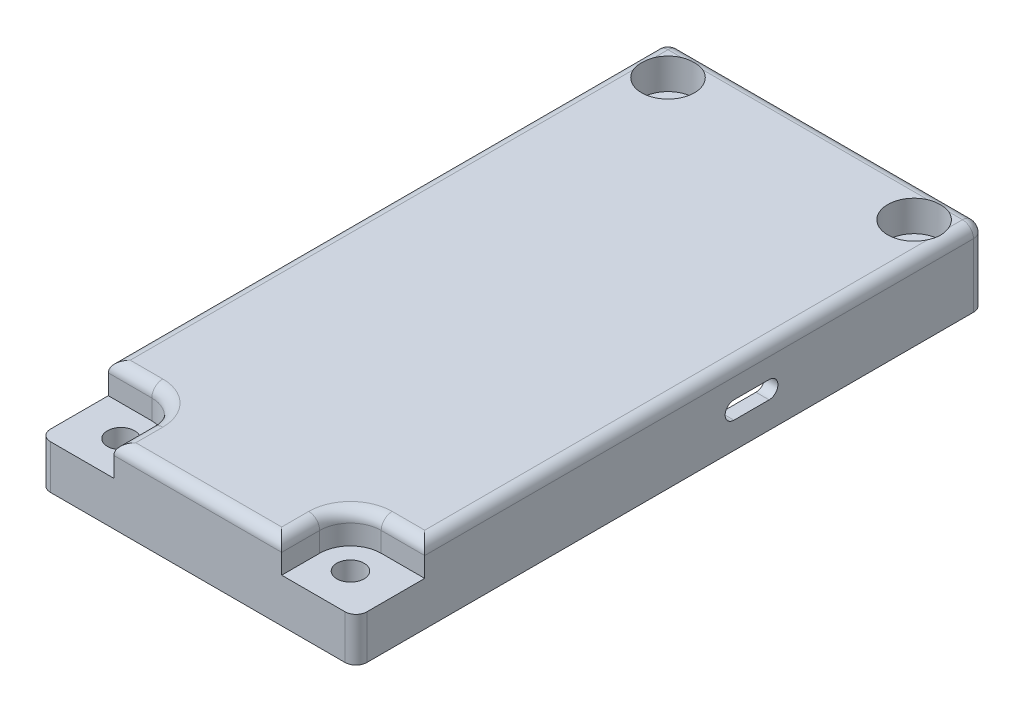
from build123d import *

# Parameters (mm, degrees)
SKETCH1_W           = 36
SKETCH1_H           = 71.5
BOSS_EXTRUDE1_DEPTH = 8.5
SKETCH2_W           = 33
SKETCH2_H           = 62.75
CUT_EXTRUDE1_DEPTH  = 7
SKETCH4_W           = 16
SKETCH4_H           = 1.25
CUT_EXTRUDE2_DEPTH  = 6.5
FILLET1_R           = 1.25
SKETCH7_W           = 7
SKETCH7_H           = 7
BOSS_EXTRUDE4_DEPTH = 7
SKETCH8_R           = 1.55
CUT_EXTRUDE3_DEPTH  = 81.50155278
SKETCH9_R           = 3
CUT_EXTRUDE4_DEPTH  = 3.5
CUT_EXTRUDE5_DEPTH  = 80.842031537
SKETCH11_W          = 5
SKETCH11_H          = 5
BOSS_EXTRUDE8_DEPTH = 4.31
FILLET2_R           = 1.25


# Some blends are built 0.0001 mm under size
with BuildPart() as part:
    # Sketch1 → Boss-Extrude1 (new body)
    with BuildSketch(Plane(origin=(0, 0, 0), x_dir=(1, 0, 0), z_dir=(0, 1, 0))):
        with Locations((18, 35.75)):
            Rectangle(SKETCH1_W, SKETCH1_H)
    extrude(amount=BOSS_EXTRUDE1_DEPTH)

    # Sketch2 → Cut-Extrude1 (cut)
    with BuildSketch(Plane.XZ):
        with Locations((18, -32.875)):
            Rectangle(SKETCH2_W, SKETCH2_H)
    extrude(amount=-CUT_EXTRUDE1_DEPTH, mode=Mode.SUBTRACT)

    # Sketch4 → Cut-Extrude2 (cut)
    with BuildSketch(Plane(origin=(0, 0, -71.5), x_dir=(-1, 0, 0), z_dir=(0, 0, -1))):
        with Locations((-18, 0.625)):
            Rectangle(SKETCH4_W, SKETCH4_H)
    extrude(amount=-CUT_EXTRUDE2_DEPTH, mode=Mode.SUBTRACT)

    # Fillet1
    fillet1_edges = [part.edges().sort_by_distance(p)[0] for p in [
        (26, 1.25, -68.25),
        (10, 1.25, -68.25),
    ]]
    fillet(fillet1_edges, radius=FILLET1_R - 0.0001)  # a hair under: the kernel refuses the full size

    # Sketch7 → Boss-Extrude4 (add)
    with BuildSketch(Plane.XZ.offset(-7)):
        with Locations((31, -5)):
            Rectangle(SKETCH7_W, SKETCH7_H)
        with Locations((5, -5)):
            Rectangle(SKETCH7_W, SKETCH7_H)
    extrude(amount=BOSS_EXTRUDE4_DEPTH)

    # Sketch8 → Cut-Extrude3 (cut, through all)
    with BuildSketch(Plane(origin=(0, 0, 0), x_dir=(-1, 0, 0), z_dir=(0, -1, 0))):
        with Locations(Location((-31.05, 4.32, 0), (0, 0, 90))):
            Circle(SKETCH8_R)
        with Locations(Location((-32, 67.5, 0), (0, 0, 90))):
            Circle(SKETCH8_R)
        with Locations(Location((-4, 67.5, 0), (0, 0, 90))):
            Circle(SKETCH8_R)
        with Locations(Location((-4.95, 4.32, 0), (0, 0, 90))):
            Circle(SKETCH8_R)
    extrude(amount=-CUT_EXTRUDE3_DEPTH, mode=Mode.SUBTRACT)

    # Sketch9 → Cut-Extrude4 (cut)
    with BuildSketch(Plane(origin=(0, 8.5, 0), x_dir=(1, 0, 0), z_dir=(0, 1, 0))):
        with Locations(Location((4, 67.5, 0), (0, 0, 270))):
            Circle(SKETCH9_R)
        with Locations(Location((32, 67.5, 0), (0, 0, 270))):
            Circle(SKETCH9_R)
        with BuildLine():
            Line((4.95, 7.82), (0, 7.82))
            Line((0, 7.82), (0, 0))
            Line((0, 0), (8.45, 0))
            Line((8.45, 0), (8.45, 4.32))
            ThreePointArc((8.45, 4.32), (7.424873734, 6.794873734), (4.95, 7.82))
        make_face()
        with BuildLine():
            Line((27.55, 4.32), (27.55, 0))
            Line((27.55, 0), (36, 0))
            Line((36, 0), (36, 7.82))
            Line((36, 7.82), (31.05, 7.82))
            ThreePointArc((31.05, 7.82), (28.575126266, 6.794873734), (27.55, 4.32))
        make_face()
    extrude(amount=-CUT_EXTRUDE4_DEPTH, mode=Mode.SUBTRACT)

    # Sketch10 → Cut-Extrude5 (cut, through all)
    with BuildSketch(Plane.ZY.offset(-34.5)):
        with BuildLine():
            Line((-47, 5), (-43, 5))
            ThreePointArc((-43, 5), (-42, 4), (-43, 3))
            Line((-43, 3), (-47, 3))
            ThreePointArc((-47, 3), (-48, 4), (-47, 5))
        make_face()
    extrude(amount=-CUT_EXTRUDE5_DEPTH, mode=Mode.SUBTRACT)

    # Sketch11 → Boss-Extrude8 (add)
    with BuildSketch(Plane.XZ.offset(-7)):
        with Locations((4, -61.75)):
            Rectangle(SKETCH11_W, SKETCH11_H)
        with Locations((32, -61.75)):
            Rectangle(SKETCH11_W, SKETCH11_H)
    extrude(amount=BOSS_EXTRUDE8_DEPTH)

    # Fillet2
    # the kernel refuses this fillet: 1.25 mm, written as the material it takes off along each edge
    with BuildSketch(Plane(origin=(34.75, 7.25, -70.25), x_dir=(1, 0, 0), z_dir=(0, 0, -1))) as fillet2_piece_1_section:
        Polygon((0, 0), (FILLET2_R, 0), (FILLET2_R, -FILLET2_R), (0, -FILLET2_R), align=None)
    fillet2_piece_1 = extrude(amount=FILLET2_R, mode=Mode.PRIVATE)
    fillet2_piece_1 = fillet2_piece_1 - Plane(origin=(34.75, 7.25, -70.25), x_dir=(-0.7071067811865475, -0.7071067811865475, 0), z_dir=(0, 0, -1)) * Sphere(FILLET2_R, mode=Mode.PRIVATE)
    add(fillet2_piece_1, mode=Mode.SUBTRACT)
    with BuildSketch(Plane(origin=(1.25, 7.25, -70.25), x_dir=(-1, 0, 0), z_dir=(0, 0, -1))) as fillet2_piece_2_section:
        Polygon((0, 0), (FILLET2_R, 0), (FILLET2_R, FILLET2_R), (0, FILLET2_R), align=None)
    fillet2_piece_2 = extrude(amount=FILLET2_R, mode=Mode.PRIVATE)
    fillet2_piece_2 = fillet2_piece_2 - Plane(origin=(1.25, 7.25, -70.25), x_dir=(0.7071067811865475, -0.7071067811865475, 0), z_dir=(0, 0, -1)) * Sphere(FILLET2_R, mode=Mode.PRIVATE)
    add(fillet2_piece_2, mode=Mode.SUBTRACT)
    with BuildSketch(Plane(origin=(5.325, 8.5, 0), x_dir=(0, 0, -1), z_dir=(1, 0, 0))) as fillet2_piece_3:
        with BuildLine():
            CenterArc((FILLET2_R, -FILLET2_R), FILLET2_R, 90, 90)
            Line((0, -FILLET2_R), (0, 0))
            Line((0, 0), (FILLET2_R, 0))
        make_face()
    extrude(amount=25.35, mode=Mode.SUBTRACT)
    with BuildSketch(Plane(origin=(36, 8.5, -4.695), x_dir=(0, -1, 0), z_dir=(0, 0, -1))) as fillet2_piece_4:
        with BuildLine():
            CenterArc((FILLET2_R, FILLET2_R), FILLET2_R, 180, 90)
            Line((0, FILLET2_R), (0, 0))
            Line((0, 0), (FILLET2_R, 0))
        make_face()
    extrude(amount=65.555, mode=Mode.SUBTRACT)
    with BuildSketch(Plane(origin=(36, -3.125, 0), x_dir=(0, 0, -1), z_dir=(0, 1, 0))) as fillet2_piece_5:
        with BuildLine():
            CenterArc((FILLET2_R, FILLET2_R), FILLET2_R, 180, 90)
            Line((0, FILLET2_R), (0, 0))
            Line((0, 0), (FILLET2_R, 0))
        make_face()
    extrude(amount=11.25, mode=Mode.SUBTRACT)
    with BuildSketch(Plane(origin=(0, -3.125, 0), x_dir=(0, 0, -1), z_dir=(0, 1, 0))) as fillet2_piece_6:
        with BuildLine():
            CenterArc((FILLET2_R, -FILLET2_R), FILLET2_R, 90, 90)
            Line((0, -FILLET2_R), (0, 0))
            Line((0, 0), (FILLET2_R, 0))
        make_face()
    extrude(amount=11.25, mode=Mode.SUBTRACT)
    with BuildSketch(Plane(origin=(4.95, 8.5, -4.32), x_dir=(1, 0, 0), z_dir=(0, 0, 1))) as fillet2_piece_7:
        with BuildLine():
            CenterArc((3.5 + FILLET2_R, -FILLET2_R), FILLET2_R, 90, 90)
            Line((3.5, -FILLET2_R), (3.5, 0))
            Line((3.5, 0), (3.5 + FILLET2_R, 0))
        make_face()
    revolve(axis=Axis((4.95, 8.5, -4.32), (0, 1, 0)), revolution_arc=90, mode=Mode.SUBTRACT)
    with BuildSketch(Plane(origin=(4.95, 8.5, -7.82), x_dir=(0, 0, -1), z_dir=(-1, 0, 0)), Plane(origin=(39.125, 8.5, -7.82), x_dir=(0, 0, -1), z_dir=(-1, 0, 0))) as fillet2_piece_8:
        with BuildLine():
            CenterArc((FILLET2_R, FILLET2_R), FILLET2_R, 180, 90)
            Line((0, FILLET2_R), (0, 0))
            Line((0, 0), (FILLET2_R, 0))
        make_face()
    extrude(amount=8.075, mode=Mode.SUBTRACT)
    with BuildSketch(Plane(origin=(8.45, 8.5, 3.125), x_dir=(1, 0, 0), z_dir=(0, 0, -1)), Plane(origin=(27.55, 8.5, -4.32), x_dir=(-1, 0, 0), z_dir=(0, 0, 1))) as fillet2_piece_9:
        with BuildLine():
            CenterArc((FILLET2_R, FILLET2_R), FILLET2_R, 180, 90)
            Line((0, FILLET2_R), (0, 0))
            Line((0, 0), (FILLET2_R, 0))
        make_face()
    extrude(amount=7.445, mode=Mode.SUBTRACT)
    with BuildSketch(Plane(origin=(31.05, 8.5, -4.32), x_dir=(0, 0, -1), z_dir=(1, 0, 0))) as fillet2_piece_10:
        with BuildLine():
            CenterArc((3.5 + FILLET2_R, -FILLET2_R), FILLET2_R, 90, 90)
            Line((3.5, -FILLET2_R), (3.5, 0))
            Line((3.5, 0), (3.5 + FILLET2_R, 0))
        make_face()
    revolve(axis=Axis((31.05, 8.5, -4.32), (0, 1, 0)), revolution_arc=90, mode=Mode.SUBTRACT)
    with BuildSketch(Plane(origin=(34.75, 8.5, -71.5), x_dir=(0, -1, 0), z_dir=(-1, 0, 0))) as fillet2_piece_11:
        with BuildLine():
            CenterArc((FILLET2_R, FILLET2_R), FILLET2_R, 180, 90)
            Line((0, FILLET2_R), (0, 0))
            Line((0, 0), (FILLET2_R, 0))
        make_face()
    extrude(amount=33.5, mode=Mode.SUBTRACT)
    with BuildSketch(Plane(origin=(0, 8.5, -70.25), x_dir=(1, 0, 0), z_dir=(0, 0, 1))) as fillet2_piece_12:
        with BuildLine():
            CenterArc((FILLET2_R, -FILLET2_R), FILLET2_R, 90, 90)
            Line((0, -FILLET2_R), (0, 0))
            Line((0, 0), (FILLET2_R, 0))
        make_face()
    extrude(amount=65.555, mode=Mode.SUBTRACT)
    with BuildSketch(Plane(origin=(0, -3.125, -71.5), x_dir=(1, 0, 0), z_dir=(0, 1, 0))) as fillet2_piece_13:
        with BuildLine():
            CenterArc((FILLET2_R, -FILLET2_R), FILLET2_R, 90, 90)
            Line((0, -FILLET2_R), (0, 0))
            Line((0, 0), (FILLET2_R, 0))
        make_face()
    extrude(amount=10.375, mode=Mode.SUBTRACT)
    with BuildSketch(Plane(origin=(36, -3.125, -71.5), x_dir=(-1, 0, 0), z_dir=(0, 1, 0))) as fillet2_piece_14:
        with BuildLine():
            CenterArc((FILLET2_R, FILLET2_R), FILLET2_R, 180, 90)
            Line((0, FILLET2_R), (0, 0))
            Line((0, 0), (FILLET2_R, 0))
        make_face()
    extrude(amount=10.375, mode=Mode.SUBTRACT)


solid = part.part
